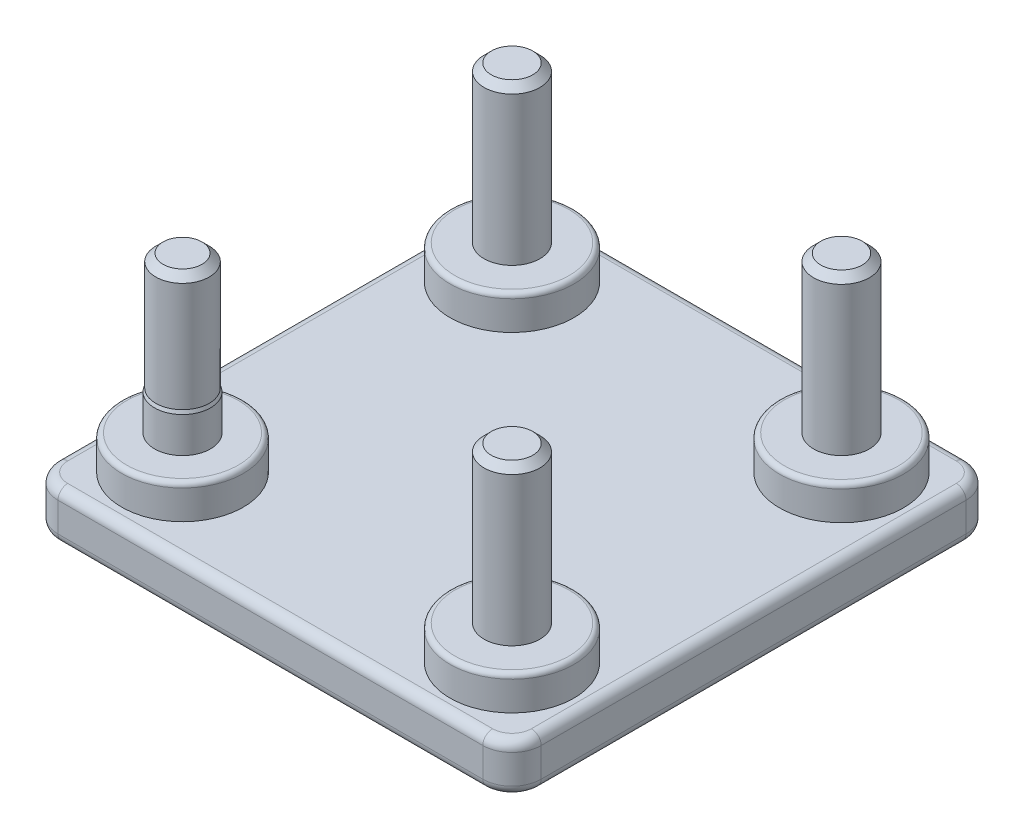
from build123d import *

# Parameters (mm, degrees)
SKETCH1_W             = 49.675
SKETCH1_H             = 49.675
BOSS_EXTRUDE1_DEPTH   = 5
CUT_EXTRUDE1_REACH    = 85.922
CUT_EXTRUDE1_START    = 1
SKETCH3_R             = 4.275
BOSS_EXTRUDE2_START   = 5
SKETCH2_R             = 6.375
BOSS_EXTRUDE2_DEPTH   = 3.5
BOSS_EXTRUDE2_2_DEPTH = 3.5
SKETCH2_R_2           = 6.25
BOSS_EXTRUDE2_3_DEPTH = 3.5
BOSS_EXTRUDE2_4_DEPTH = 3.5
BOSS_EXTRUDE3_START   = 8.5
SKETCH2_3_R           = 2.875
SKETCH2_3_R_2         = 2.75
BOSS_EXTRUDE3_DEPTH   = 16
BOSS_EXTRUDE4_START   = 5
SKETCH3_2_R           = 4
BOSS_EXTRUDE4_DEPTH   = 1.875
BOSS_EXTRUDE5_START   = 8.5
SKETCH2_4_R           = 2.875
BOSS_EXTRUDE5_DEPTH   = 4
CHAMFER6_SIZE2        = 0.125
CHAMFER6_SIZE         = 0.343434677
CHAMFER1_SIZE         = 0.75
FILLET5_R             = 3
FILLET6_R             = 1
FILLET1_R             = 0.5
FILLET2_R             = 0.5
FILLET3_R             = 0.5
FILLET4_R             = 0.5
CHAMFER2_SIZE         = 0.75
CHAMFER3_SIZE         = 0.75
CHAMFER4_SIZE         = 0.75
CHAMFER5_SIZE         = 0.75


with BuildPart() as part:
    # Sketch1 → Boss-Extrude1 (new body)
    with BuildSketch(Plane(origin=(0, 0, 0), x_dir=(1, 0, 0), z_dir=(0, 1, 0))):
        with Locations((25.009585601, 41.241057723)):
            Rectangle(SKETCH1_W, SKETCH1_H)
    extrude(amount=BOSS_EXTRUDE1_DEPTH)

    # Sketch3 → Cut-Extrude1 (cut, up to next)
    with BuildSketch(Plane(origin=(0, 0, 0), x_dir=(1, 0, 0), z_dir=(0, 1, 0)).offset(CUT_EXTRUDE1_START), mode=Mode.PRIVATE) as cut_extrude1_sk1:
        with Locations(Location((8.067285601, 24.308357723, 0), (0, 0, 90))):
            Circle(SKETCH3_R)
    cut_extrude1_tool1 = extrude(cut_extrude1_sk1.sketch, amount=CUT_EXTRUDE1_REACH, mode=Mode.PRIVATE) & part.part
    # Sketch3 → Cut-Extrude1 (cut, up to next)
    with BuildSketch(Plane(origin=(0, 0, 0), x_dir=(1, 0, 0), z_dir=(0, 1, 0)).offset(CUT_EXTRUDE1_START), mode=Mode.PRIVATE) as cut_extrude1_sk2:
        with Locations(Location((41.942285601, 24.308357723, 0), (0, 0, 90))):
            Circle(SKETCH3_R)
    cut_extrude1_tool2 = extrude(cut_extrude1_sk2.sketch, amount=CUT_EXTRUDE1_REACH, mode=Mode.PRIVATE) & part.part
    # Sketch3 → Cut-Extrude1 (cut, up to next)
    with BuildSketch(Plane(origin=(0, 0, 0), x_dir=(1, 0, 0), z_dir=(0, 1, 0)).offset(CUT_EXTRUDE1_START), mode=Mode.PRIVATE) as cut_extrude1_sk3:
        with Locations(Location((41.942285601, 58.183357723, 0), (0, 0, 90))):
            Circle(SKETCH3_R)
    cut_extrude1_tool3 = extrude(cut_extrude1_sk3.sketch, amount=CUT_EXTRUDE1_REACH, mode=Mode.PRIVATE) & part.part
    # Sketch3 → Cut-Extrude1 (cut, up to next)
    with BuildSketch(Plane(origin=(0, 0, 0), x_dir=(1, 0, 0), z_dir=(0, 1, 0)).offset(CUT_EXTRUDE1_START), mode=Mode.PRIVATE) as cut_extrude1_sk4:
        with Locations(Location((8.067285601, 58.183357723, 0), (0, 0, 90))):
            Circle(SKETCH3_R)
    cut_extrude1_tool4 = extrude(cut_extrude1_sk4.sketch, amount=CUT_EXTRUDE1_REACH, mode=Mode.PRIVATE) & part.part
    add(cut_extrude1_tool1.solids().sort_by_distance((8.067286, 1, -24.308358))[0], mode=Mode.SUBTRACT)
    add(cut_extrude1_tool2.solids().sort_by_distance((41.942286, 1, -24.308358))[0], mode=Mode.SUBTRACT)
    add(cut_extrude1_tool3.solids().sort_by_distance((41.942286, 1, -58.183358))[0], mode=Mode.SUBTRACT)
    add(cut_extrude1_tool4.solids().sort_by_distance((8.067286, 1, -58.183358))[0], mode=Mode.SUBTRACT)

    # Chamfer1
    chamfer1_edges = [part.edges().sort_by_distance(p)[0] for p in [
        (41.942285601, 5, -53.908357723),
        (8.067285601, 5, -20.033357723),
        (8.067285601, 5, -53.908357723),
        (41.942285601, 5, -20.033357723),
    ]]
    chamfer(chamfer1_edges, length=CHAMFER1_SIZE)

    # Fillet5
    fillet5_edges = [part.edges().sort_by_distance(p)[0] for p in [
        (0.172085601, 2.5, -66.078557723),
        (49.847085601, 2.5, -66.078557723),
        (49.847085601, 2.5, -16.403557723),
        (0.172085601, 2.5, -16.403557723),
    ]]
    fillet(fillet5_edges, radius=FILLET5_R)

    # Fillet6
    fillet6_edges = [part.edges().sort_by_distance(p)[0] for p in [
        (49.847085601, 0, -41.241057723),
        (49.847085601, 5, -41.241057723),
        (0.172085601, 0, -41.241057723),
        (25.009585601, 0, -66.078557723),
        (25.009585601, 0, -16.403557723),
        (1.050765257, 0, -17.282237379),
        (1.050765257, 0, -65.199878066),
        (48.968405944, 0, -65.199878066),
        (48.968405944, 0, -17.282237379),
        (25.009585601, 5, -16.403557723),
        (0.172085601, 5, -41.241057723),
        (25.009585601, 5, -66.078557723),
        (1.050765257, 5, -17.282237379),
        (1.050765257, 5, -65.199878066),
        (48.968405944, 5, -65.199878066),
        (48.968405944, 5, -17.282237379),
    ]]
    fillet(fillet6_edges, radius=FILLET6_R)


with BuildPart() as body_2:
    # Sketch2 → Boss-Extrude2 (new body)
    with BuildSketch(Plane(origin=(0, 0, 0), x_dir=(1, 0, 0), z_dir=(0, 1, 0)).offset(BOSS_EXTRUDE2_START)):
        with Locations(Location((41.942285601, 58.183357723, 0), (0, 0, 90))):
            Circle(SKETCH2_R)
    extrude(amount=BOSS_EXTRUDE2_DEPTH)



with BuildPart() as body_3:
    # Sketch2 → Boss-Extrude2 2 (new body)
    with BuildSketch(Plane(origin=(0, 0, 0), x_dir=(1, 0, 0), z_dir=(0, 1, 0)).offset(BOSS_EXTRUDE2_START)):
        with Locations(Location((41.942285601, 24.308357723, 0), (0, 0, 90))):
            Circle(SKETCH2_R)
    extrude(amount=BOSS_EXTRUDE2_2_DEPTH)


with BuildPart() as body_4:
    # Sketch2 → Boss-Extrude2 3 (new body)
    with BuildSketch(Plane(origin=(0, 0, 0), x_dir=(1, 0, 0), z_dir=(0, 1, 0)).offset(BOSS_EXTRUDE2_START)):
        with Locations(Location((8.067285601, 24.308357723, 0), (0, 0, 90))):
            Circle(SKETCH2_R_2)
    extrude(amount=BOSS_EXTRUDE2_3_DEPTH)


with BuildPart() as body_5:
    # Sketch2 → Boss-Extrude2 4 (new body)
    with BuildSketch(Plane(origin=(0, 0, 0), x_dir=(1, 0, 0), z_dir=(0, 1, 0)).offset(BOSS_EXTRUDE2_START)):
        with Locations(Location((8.067285601, 58.183357723, 0), (0, 0, 90))):
            Circle(SKETCH2_R)
    extrude(amount=BOSS_EXTRUDE2_4_DEPTH)


with BuildPart() as body_2_1:
    add(body_2.part)

    add(body_3.part)  # Boss-Extrude3 merges body 3

    add(body_4.part)  # Boss-Extrude3 merges body 4

    add(body_5.part)  # Boss-Extrude3 merges body 5
    # Sketch2<3> → Boss-Extrude3 (add)
    with BuildSketch(Plane(origin=(0, 0, 0), x_dir=(1, 0, 0), z_dir=(0, 1, 0)).offset(BOSS_EXTRUDE3_START)):
        with Locations(Location((8.067285601, 58.183357723, 0), (0, 0, 90))):
            Circle(SKETCH2_3_R)
        with Locations(Location((41.942285601, 58.183357723, 0), (0, 0, 90))):
            Circle(SKETCH2_3_R)
        with Locations(Location((41.942285601, 24.308357723, 0), (0, 0, 90))):
            Circle(SKETCH2_3_R)
        with Locations(Location((8.067285601, 24.308357723, 0), (0, 0, 90))):
            Circle(SKETCH2_3_R_2)
    extrude(amount=BOSS_EXTRUDE3_DEPTH)

    # Sketch3<2> → Boss-Extrude4 (add)
    with BuildSketch(Plane(origin=(0, 0, 0), x_dir=(1, 0, 0), z_dir=(0, 1, 0)).offset(BOSS_EXTRUDE4_START)):
        with Locations(Location((8.067285601, 58.183357723, 0), (0, 0, 90))):
            Circle(SKETCH3_2_R)
        with Locations(Location((41.942285601, 58.183357723, 0), (0, 0, 90))):
            Circle(SKETCH3_2_R)
        with Locations(Location((41.942285601, 24.308357723, 0), (0, 0, 90))):
            Circle(SKETCH3_2_R)
        with Locations(Location((8.067285601, 24.308357723, 0), (0, 0, 90))):
            Circle(SKETCH3_2_R)
    extrude(amount=-BOSS_EXTRUDE4_DEPTH)

    # Sketch2<4> → Boss-Extrude5 (add)
    with BuildSketch(Plane(origin=(0, 0, 0), x_dir=(1, 0, 0), z_dir=(0, 1, 0)).offset(BOSS_EXTRUDE5_START)):
        with Locations(Location((8.067285601, 24.308357723, 0), (0, 0, 90))):
            Circle(SKETCH2_4_R)
    extrude(amount=BOSS_EXTRUDE5_DEPTH)

    # Chamfer6
    chamfer6_edges = [body_2_1.edges().sort_by_distance(p)[0] for p in [
        (8.067285601, 12.5, -21.433357723),
    ]]
    chamfer6_side = [body_2_1.faces().sort_by_distance(p)[0] for p in [
        (8.067285601, 12.4975, -21.433357723),
    ]]
    chamfer(chamfer6_edges, length=CHAMFER6_SIZE - 0.0001, length2=CHAMFER6_SIZE2 - 0.0001, reference=chamfer6_side[0])  # a hair under: the kernel refuses the full size

    # Fillet1
    fillet1_edges = [body_2_1.edges().sort_by_distance(p)[0] for p in [
        (8.067285601, 8.5, -18.058357723),
    ]]
    fillet(fillet1_edges, radius=FILLET1_R)

    # Fillet2
    fillet2_edges = [body_2_1.edges().sort_by_distance(p)[0] for p in [
        (41.942285601, 8.5, -17.933357723),
    ]]
    fillet(fillet2_edges, radius=FILLET2_R)

    # Fillet3
    fillet3_edges = [body_2_1.edges().sort_by_distance(p)[0] for p in [
        (8.067285601, 8.5, -51.808357723),
    ]]
    fillet(fillet3_edges, radius=FILLET3_R)

    # Fillet4
    fillet4_edges = [body_2_1.edges().sort_by_distance(p)[0] for p in [
        (41.942285601, 8.5, -51.808357723),
    ]]
    fillet(fillet4_edges, radius=FILLET4_R)

    # Chamfer2
    chamfer2_edges = [body_2_1.edges().sort_by_distance(p)[0] for p in [
        (8.067285601, 24.5, -21.558357723),
    ]]
    chamfer(chamfer2_edges, length=CHAMFER2_SIZE)

    # Chamfer3
    chamfer3_edges = [body_2_1.edges().sort_by_distance(p)[0] for p in [
        (8.067285601, 24.5, -55.308357723),
    ]]
    chamfer(chamfer3_edges, length=CHAMFER3_SIZE)

    # Chamfer4
    chamfer4_edges = [body_2_1.edges().sort_by_distance(p)[0] for p in [
        (41.942285601, 24.5, -55.308357723),
    ]]
    chamfer(chamfer4_edges, length=CHAMFER4_SIZE)

    # Chamfer5
    chamfer5_edges = [body_2_1.edges().sort_by_distance(p)[0] for p in [
        (41.942285601, 24.5, -21.433357723),
    ]]
    chamfer(chamfer5_edges, length=CHAMFER5_SIZE)


solid = Compound([part.part, body_2_1.part])
